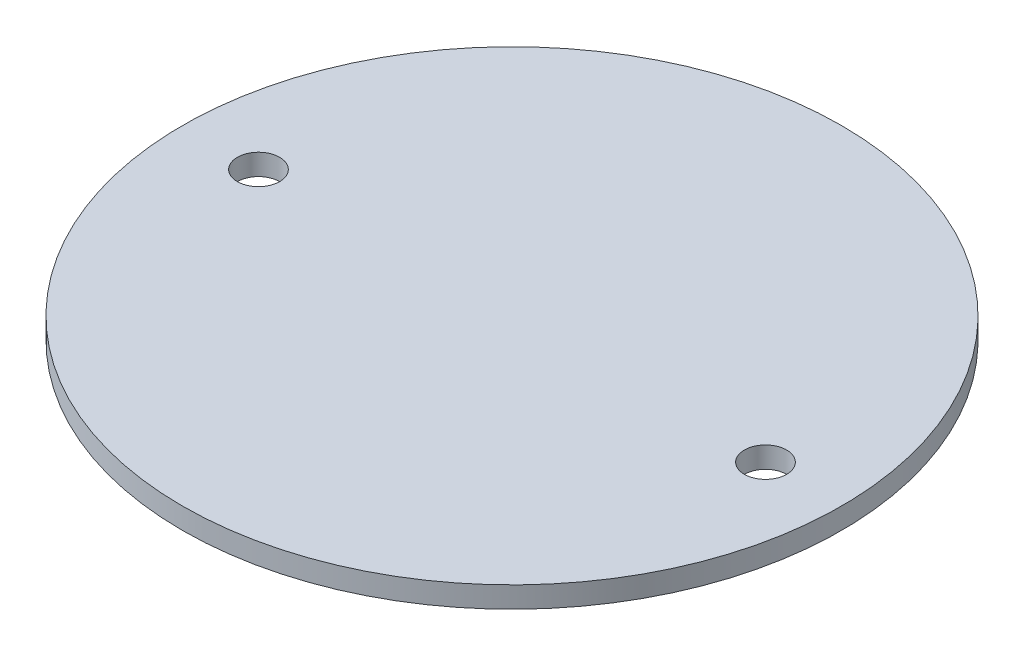
from build123d import *

# Parameters (mm, degrees)
SKETCH1_R           = 49.53
BOSS_EXTRUDE1_DEPTH = 3.175
SKETCH2_R           = 3.175
CUT_EXTRUDE1_DEPTH  = 263.398


with BuildPart() as part:
    # Sketch1 → Boss-Extrude1 (new body)
    with BuildSketch(Plane(origin=(0, 0, 0), x_dir=(1, 0, 0), z_dir=(0, 1, 0))):
        Circle(SKETCH1_R)
    extrude(amount=BOSS_EXTRUDE1_DEPTH)

    # Sketch2 → Cut-Extrude1 (cut)
    with BuildSketch(Plane(origin=(-55.039702575, 234.95, -116.088398355), x_dir=(-1, 0, 0), z_dir=(0, 1, 0))):
        with Locations((-93.139702575, 116.088398355)):
            Circle(SKETCH2_R)
        with Locations((-16.939702575, 116.088398355)):
            Circle(SKETCH2_R)
    extrude(amount=-CUT_EXTRUDE1_DEPTH, mode=Mode.SUBTRACT)


solid = part.part
